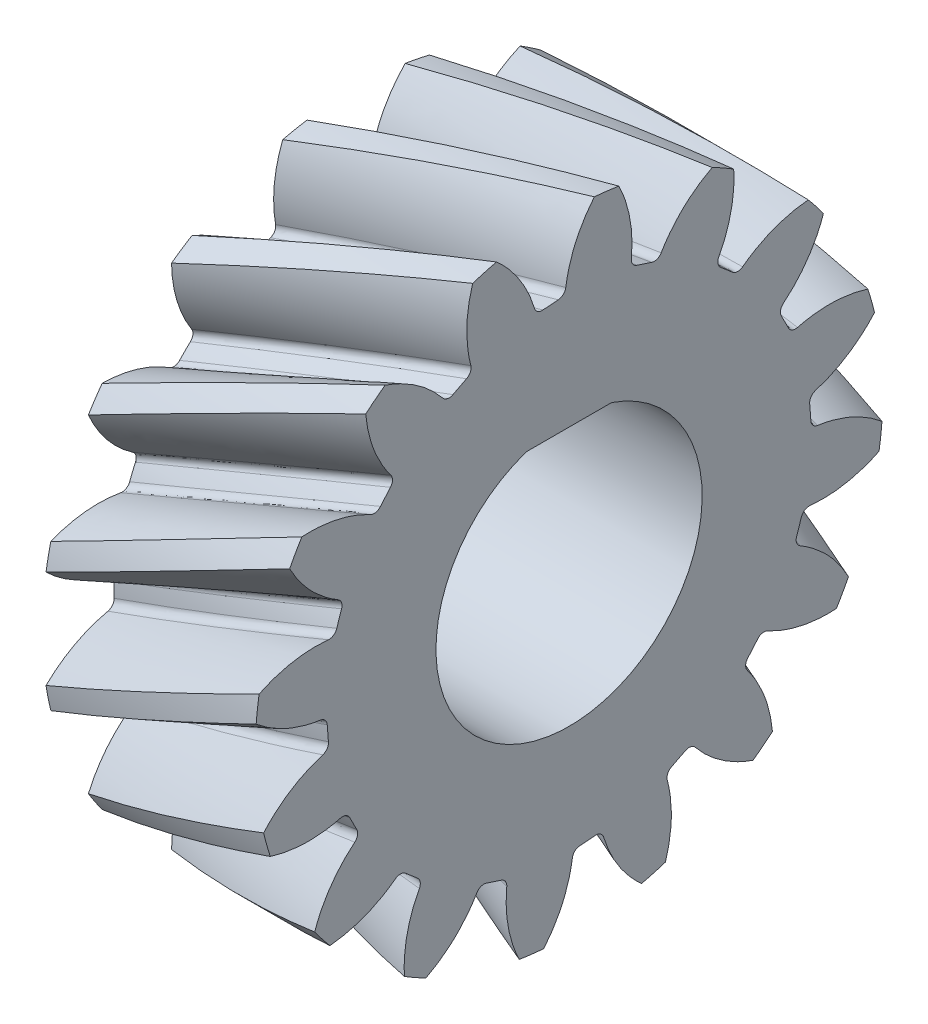
from build123d import *

# Parameters (mm, degrees)
BASPROSKE_W            = 40
BASPROSKE_H            = 58.96214011
TOOTHCUTLH_PITCH       = 794.475591257
TOOTHCUTLH_HEIGHT      = 40
TOOTHCUTLH_RADIUS      = 58.96214011
TOOTHCUTLH_START_ANGLE = -90
TEETHCUTSLH_COUNT      = 16
TEETHCUTSLH_ANGLE      = 337.5
BORSKE_R               = 25
BORE_DEPTH             = 62.5000025
KEYSKE_W               = 16
KEYSKE_H               = 29.3
KEYWAY_DEPTH           = 62.5000025
SKETCH3_W              = 16
SKETCH3_H              = 5.614561435
BOSS_EXTRUDE1_DEPTH    = 40


with BuildPart() as part:
    # BasProSke → Base-Revolve (revolve)
    with BuildSketch(Plane(origin=(0, 0, 0), x_dir=(1, 0, 0), z_dir=(0, 1, 0)), mode=Mode.PRIVATE) as base_revolve_sk:
        with Locations((20, 29.481070055)):
            Rectangle(BASPROSKE_W, BASPROSKE_H)
    revolve(base_revolve_sk.sketch.rotate(Axis((-10, 0, 0), (1, 0, 0)), 180), axis=Axis((-10, 0, 0), (1, 0, 0)))

    # ToothCutLH: sweep along a helix
    with BuildLine() as toothcutlh_path:
        add(Helix(TOOTHCUTLH_PITCH, TOOTHCUTLH_HEIGHT, TOOTHCUTLH_RADIUS, center=(0, 0, 0), direction=(1, 0, 0), lefthand=True, mode=Mode.PRIVATE).rotate(Axis((0, 0, 0), (1, 0, 0)), TOOTHCUTLH_START_ANGLE))
    # TooCutSkeRH<3> → ToothCutLH (sweep, cut)
    with BuildSketch(Plane(origin=(0, 0, 0), x_dir=(0, 0, -1), z_dir=(1, 0, 0))):
        with BuildLine():
            ThreePointArc((1.432405476, 45.439568637), (0, 45.46214011), (-1.432405476, 45.439568637))
            ThreePointArc((-1.432405476, 45.439568637), (-2.40167441, 45.755356708), (-2.945678806, 46.617484071))
            ThreePointArc((-2.945678806, 46.617484071), (-5.819383639, 53.833821663), (-10.847332194, 59.754416316))
            ThreePointArc((-10.847332194, 59.754416316), (0, 60.731004314), (10.847332194, 59.754416316))
            ThreePointArc((10.847332194, 59.754416316), (5.819383639, 53.833821663), (2.945678806, 46.617484071))
            ThreePointArc((2.945678806, 46.617484071), (2.40167441, 45.755356708), (1.432405476, 45.439568637))
        make_face()
    toothcutlh = sweep(path=toothcutlh_path.line, is_frenet=True, mode=Mode.SUBTRACT)

    # TeethCutsLH: ToothCutLH ×16 about axis
    teethcutslh_axis = Axis((-10, 0, 0), (1, 0, 0))
    for i in range(1, TEETHCUTSLH_COUNT):
        add(toothcutlh.rotate(teethcutslh_axis, i * TEETHCUTSLH_ANGLE / (TEETHCUTSLH_COUNT - 1)), mode=Mode.SUBTRACT)

    # BorSke → Bore (cut, symmetric)
    with BuildSketch(Plane(origin=(0, 0, 0), x_dir=(0, 0, -1), z_dir=(1, 0, 0))):
        with Locations(Location((0, 0, 0), (0, 0, 180))):
            Circle(BORSKE_R)
    extrude(amount=BORE_DEPTH, both=True, mode=Mode.SUBTRACT)

    # KeySke → Keyway (cut, symmetric)
    with BuildSketch(Plane(origin=(0, 0, 0), x_dir=(0, 0, -1), z_dir=(1, 0, 0))):
        with Locations((0, 14.65)):
            Rectangle(KEYSKE_W, KEYSKE_H)
    extrude(amount=KEYWAY_DEPTH, both=True, mode=Mode.SUBTRACT)

    # Sketch3 → Boss-Extrude1 (add)
    with BuildSketch(Plane(origin=(40, 0, 0), x_dir=(0, 0, -1), z_dir=(1, 0, 0))):
        with Locations((0, 26.492719283)):
            Rectangle(SKETCH3_W, SKETCH3_H)
    extrude(amount=-BOSS_EXTRUDE1_DEPTH)


solid = part.part
